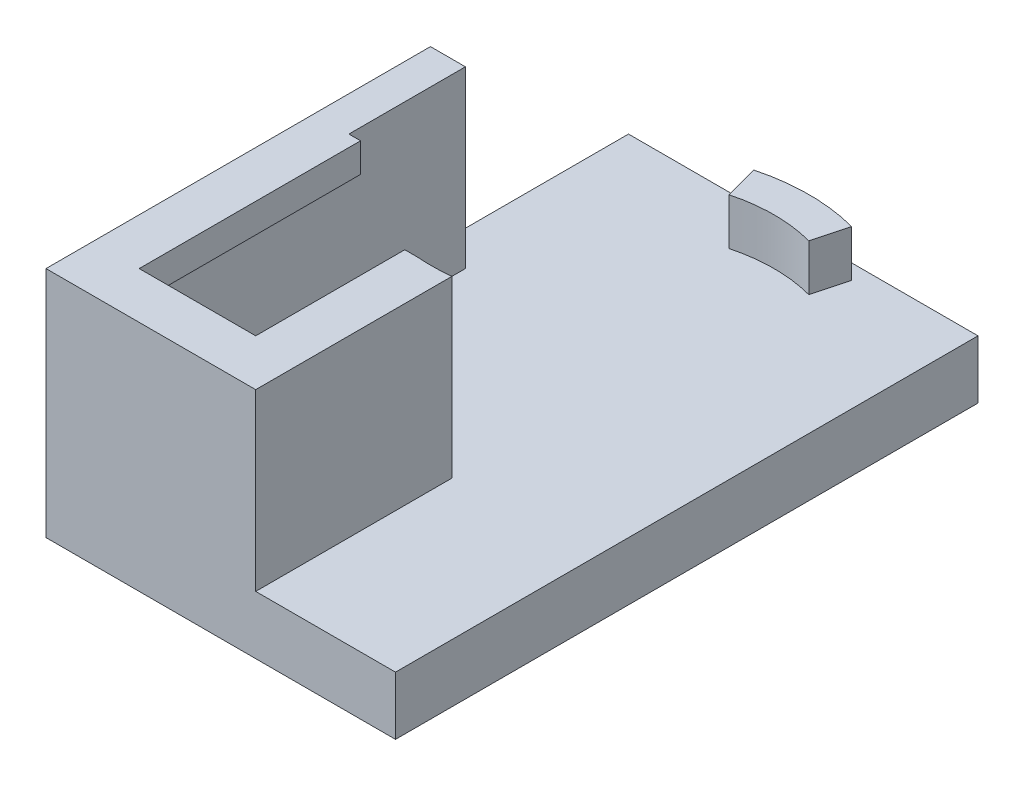
from build123d import *

# Parameters (mm, degrees)
SKETCH1_W               = 45
SKETCH1_H               = 85
BOSS_EXTRUDE1_DEPTH     = 100
SHELL1_T                = -5
BOSS_EXTRUDE2_DEPTH     = 15
SKETCH4_W               = 20
SKETCH4_H               = 2.5
BOSS_EXTRUDE3_DEPTH     = 1
SKETCH5_W               = 13.798148254
SKETCH5_H               = 2.5
BOSS_EXTRUDE4_DEPTH     = 1
SKETCH6_W               = 10
SKETCH6_H               = 2.5
BOSS_EXTRUDE5_DEPTH     = 1
SKETCH9_W               = 10.477527882
SKETCH9_H               = 6.322646136
CUT_EXTRUDE1_DEPTH      = 11
CUT_EXTRUDE2_DEPTH      = 107.477697195
CUT_EXTRUDE2_DEPTH_BACK = 107.477697195
SKETCH10_W              = 54.233150032
SKETCH10_H              = 93.874108495
SKETCH10_W_2            = 30
SKETCH10_H_2            = 50


with BuildPart() as part:
    # Sketch1 → Boss-Extrude1 (new body)
    with BuildSketch(Plane(origin=(0, 0, 0), x_dir=(1, 0, 0), z_dir=(0, 1, 0))):
        Rectangle(SKETCH1_W, SKETCH1_H)
    extrude(amount=BOSS_EXTRUDE1_DEPTH)

    # Shell1
    shell1_openings = [part.faces().sort_by_distance(p)[0] for p in [
        (0, 100, 0),
    ]]
    offset(amount=SHELL1_T, openings=shell1_openings, kind=Kind.INTERSECTION)

    # Sketch2 → Boss-Extrude2 (add)
    with BuildSketch(Plane(origin=(0, 5, 0), x_dir=(1, 0, 0), z_dir=(0, 1, 0))):
        with BuildLine():
            Line((-16.25, 0), (-16.25, -33))
            Line((-16.25, -33), (1.75, -33))
            Line((1.75, -33), (1.75, -16.155494421))
            ThreePointArc((1.75, -16.155494421), (0.251072202, -16.248060277), (-1.25, -16.201851746))
            Line((-1.25, -16.201851746), (-1.25, -30))
            Line((-1.25, -30), (-13.25, -30))
            Line((-13.25, -30), (-13.25, 0))
            Line((-13.25, 0), (-16.25, 0))
        make_face()
        with BuildLine():
            Line((-4.205809483, 15.696294677), (-3.429352348, 12.798517198))
            ThreePointArc((-3.429352348, 12.798517198), (0, 13.25), (3.429352348, 12.798517198))
            Line((3.429352348, 12.798517198), (4.205809483, 15.696294677))
            ThreePointArc((4.205809483, 15.696294677), (0, 16.25), (-4.205809483, 15.696294677))
        make_face()
    extrude(amount=BOSS_EXTRUDE2_DEPTH)

    # Sketch4 → Boss-Extrude3 (add)
    with BuildSketch(Plane(origin=(-13.25, 0, 0), x_dir=(0, 0, -1), z_dir=(1, 0, 0))):
        with Locations((-20, 18.75)):
            Rectangle(SKETCH4_W, SKETCH4_H)
    extrude(amount=BOSS_EXTRUDE3_DEPTH)

    # Sketch5 → Boss-Extrude4 (add)
    with BuildSketch(Plane.ZY.offset(1.25)):
        with Locations((23.100925873, 18.75)):
            Rectangle(SKETCH5_W, SKETCH5_H)
    extrude(amount=BOSS_EXTRUDE4_DEPTH)

    # Sketch6 → Boss-Extrude5 (add)
    with BuildSketch(Plane(origin=(0, 0, 30), x_dir=(-1, 0, 0), z_dir=(0, 0, -1))):
        with Locations((7.25, 18.75)):
            Rectangle(SKETCH6_W, SKETCH6_H)
    extrude(amount=BOSS_EXTRUDE5_DEPTH)

    # Sketch9 → Cut-Extrude1 (cut)
    with BuildSketch(Plane(origin=(0, 20, 0), x_dir=(1, 0, 0), z_dir=(0, 1, 0))):
        with Locations((0.163497959, 14.216347227)):
            Rectangle(SKETCH9_W, SKETCH9_H)
    extrude(amount=-CUT_EXTRUDE1_DEPTH, mode=Mode.SUBTRACT)

    # Sketch10 → Cut-Extrude2 (cut, two sides: drawn at the far end of the back side and taken through both)
    with BuildSketch(Plane(origin=(0, 5, 0), x_dir=(1, 0, 0), z_dir=(0, 1, 0)).offset(-CUT_EXTRUDE2_DEPTH_BACK)):
        with Locations((1.369563357, 1.0979216)):
            Rectangle(SKETCH10_W, SKETCH10_H)
        with Locations((-1.25, -8)):
            Rectangle(SKETCH10_W_2, SKETCH10_H_2, mode=Mode.SUBTRACT)
    extrude(amount=CUT_EXTRUDE2_DEPTH + CUT_EXTRUDE2_DEPTH_BACK, mode=Mode.SUBTRACT)


solid = part.part
